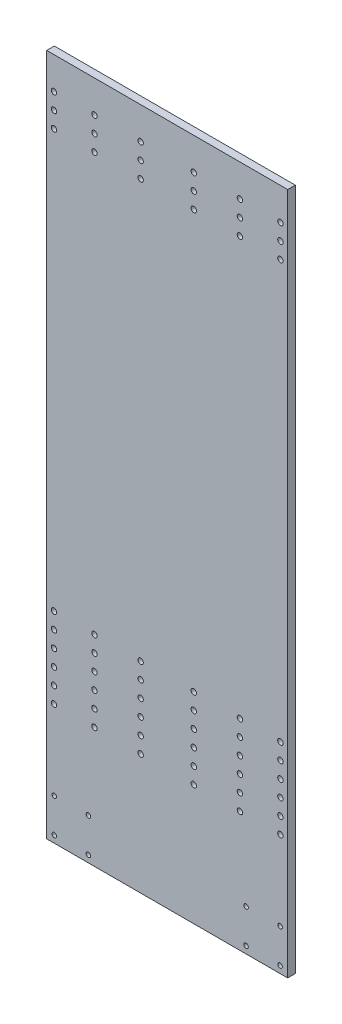
from build123d import *

# Parameters (mm, degrees)
ESQUISSE1_W              = 190.5
ESQUISSE1_H              = 539.75
BOSS_EXTRU_1_DEPTH       = 6
D_GAGEMENT_M41_OUTLINE_R = 2.15
D_GAGEMENT_M41_DEPTH     = 6
D_GAGEMENT_M31_D         = 3.6
D_GAGEMENT_M31_DEPTH     = 6
D_GAGEMENT_M31_TIP       = 1.081549114


# Read off the part's stored shape, not the designer's step: Dégagement M41
with BuildPart() as part:
    # Esquisse1 → Boss.-Extru.1 (new body)
    with BuildSketch(Plane.XY):
        Rectangle(ESQUISSE1_W, ESQUISSE1_H)
    extrude(amount=BOSS_EXTRU_1_DEPTH)

    # Dégagement M41 outline → Dégagement M41 (cut)
    with BuildSketch(Plane.XY):
        with Locations((89.49, -174.625)):
            Circle(D_GAGEMENT_M41_OUTLINE_R)
        with Locations((57.49, -174.625)):
            Circle(D_GAGEMENT_M41_OUTLINE_R)
        with Locations((21, -174.625)):
            Circle(D_GAGEMENT_M41_OUTLINE_R)
        with Locations((-21, -174.625)):
            Circle(D_GAGEMENT_M41_OUTLINE_R)
        with Locations((-57.49, -174.625)):
            Circle(D_GAGEMENT_M41_OUTLINE_R)
        with Locations((-89.49, -174.625)):
            Circle(D_GAGEMENT_M41_OUTLINE_R)
        with Locations((89.49, -161.925)):
            Circle(D_GAGEMENT_M41_OUTLINE_R)
        with Locations((57.49, -161.925)):
            Circle(D_GAGEMENT_M41_OUTLINE_R)
        with Locations((21, -161.925)):
            Circle(D_GAGEMENT_M41_OUTLINE_R)
        with Locations((-21, -161.925)):
            Circle(D_GAGEMENT_M41_OUTLINE_R)
        with Locations((-57.49, -161.925)):
            Circle(D_GAGEMENT_M41_OUTLINE_R)
        with Locations((-89.49, -161.925)):
            Circle(D_GAGEMENT_M41_OUTLINE_R)
        with Locations((89.49, -149.225)):
            Circle(D_GAGEMENT_M41_OUTLINE_R)
        with Locations((57.49, -149.225)):
            Circle(D_GAGEMENT_M41_OUTLINE_R)
        with Locations((21, -149.225)):
            Circle(D_GAGEMENT_M41_OUTLINE_R)
        with Locations((-21, -149.225)):
            Circle(D_GAGEMENT_M41_OUTLINE_R)
        with Locations((-57.49, -149.225)):
            Circle(D_GAGEMENT_M41_OUTLINE_R)
        with Locations((-89.49, -149.225)):
            Circle(D_GAGEMENT_M41_OUTLINE_R)
        with Locations((89.49, -136.525)):
            Circle(D_GAGEMENT_M41_OUTLINE_R)
        with Locations((57.49, -136.525)):
            Circle(D_GAGEMENT_M41_OUTLINE_R)
        with Locations((21, -136.525)):
            Circle(D_GAGEMENT_M41_OUTLINE_R)
        with Locations((-21, -136.525)):
            Circle(D_GAGEMENT_M41_OUTLINE_R)
        with Locations((-57.49, -136.525)):
            Circle(D_GAGEMENT_M41_OUTLINE_R)
        with Locations((-89.49, -136.525)):
            Circle(D_GAGEMENT_M41_OUTLINE_R)
        with Locations((89.49, -123.825)):
            Circle(D_GAGEMENT_M41_OUTLINE_R)
        with Locations((57.49, -123.825)):
            Circle(D_GAGEMENT_M41_OUTLINE_R)
        with Locations((21, -123.825)):
            Circle(D_GAGEMENT_M41_OUTLINE_R)
        with Locations((-21, -123.825)):
            Circle(D_GAGEMENT_M41_OUTLINE_R)
        with Locations((-57.49, -123.825)):
            Circle(D_GAGEMENT_M41_OUTLINE_R)
        with Locations((-89.49, -123.825)):
            Circle(D_GAGEMENT_M41_OUTLINE_R)
        with Locations((89.49, -111.125)):
            Circle(D_GAGEMENT_M41_OUTLINE_R)
        with Locations((57.49, -111.125)):
            Circle(D_GAGEMENT_M41_OUTLINE_R)
        with Locations((21, -111.125)):
            Circle(D_GAGEMENT_M41_OUTLINE_R)
        with Locations((-21, -111.125)):
            Circle(D_GAGEMENT_M41_OUTLINE_R)
        with Locations((-57.49, -111.125)):
            Circle(D_GAGEMENT_M41_OUTLINE_R)
        with Locations((-89.49, -111.125)):
            Circle(D_GAGEMENT_M41_OUTLINE_R)
        with Locations((89.49, 219.075)):
            Circle(D_GAGEMENT_M41_OUTLINE_R)
        with Locations((57.49, 219.075)):
            Circle(D_GAGEMENT_M41_OUTLINE_R)
        with Locations((21, 219.075)):
            Circle(D_GAGEMENT_M41_OUTLINE_R)
        with Locations((-21, 219.075)):
            Circle(D_GAGEMENT_M41_OUTLINE_R)
        with Locations((-57.49, 219.075)):
            Circle(D_GAGEMENT_M41_OUTLINE_R)
        with Locations((-89.49, 219.075)):
            Circle(D_GAGEMENT_M41_OUTLINE_R)
        with Locations((89.49, 231.775)):
            Circle(D_GAGEMENT_M41_OUTLINE_R)
        with Locations((57.49, 231.775)):
            Circle(D_GAGEMENT_M41_OUTLINE_R)
        with Locations((21, 231.775)):
            Circle(D_GAGEMENT_M41_OUTLINE_R)
        with Locations((-21, 231.775)):
            Circle(D_GAGEMENT_M41_OUTLINE_R)
        with Locations((-57.49, 231.775)):
            Circle(D_GAGEMENT_M41_OUTLINE_R)
        with Locations((-89.49, 231.775)):
            Circle(D_GAGEMENT_M41_OUTLINE_R)
        with Locations((89.49, 244.475)):
            Circle(D_GAGEMENT_M41_OUTLINE_R)
        with Locations((57.49, 244.475)):
            Circle(D_GAGEMENT_M41_OUTLINE_R)
        with Locations((21, 244.475)):
            Circle(D_GAGEMENT_M41_OUTLINE_R)
        with Locations((-21, 244.475)):
            Circle(D_GAGEMENT_M41_OUTLINE_R)
        with Locations((-57.49, 244.475)):
            Circle(D_GAGEMENT_M41_OUTLINE_R)
        with Locations((-89.49, 244.475)):
            Circle(D_GAGEMENT_M41_OUTLINE_R)
    extrude(amount=D_GAGEMENT_M41_DEPTH, mode=Mode.SUBTRACT)

    # Dégagement M31
    with Locations(Plane(origin=(-89.25, -237.355, 6), x_dir=(1, 0, 0), z_dir=(0, 0, 1))):
        with Locations((0, 0), (26.94, 0), (0, -26.94), (26.94, -26.94), (151.56, 0), (178.5, 0), (151.56, -26.94), (178.5, -26.94)):
            Hole(D_GAGEMENT_M31_D / 2, depth=D_GAGEMENT_M31_DEPTH)
            with Locations((0, 0, -(D_GAGEMENT_M31_DEPTH + D_GAGEMENT_M31_TIP / 2))):  # 118° drill point
                Cone(0, D_GAGEMENT_M31_D / 2, D_GAGEMENT_M31_TIP, mode=Mode.SUBTRACT)


solid = part.part
